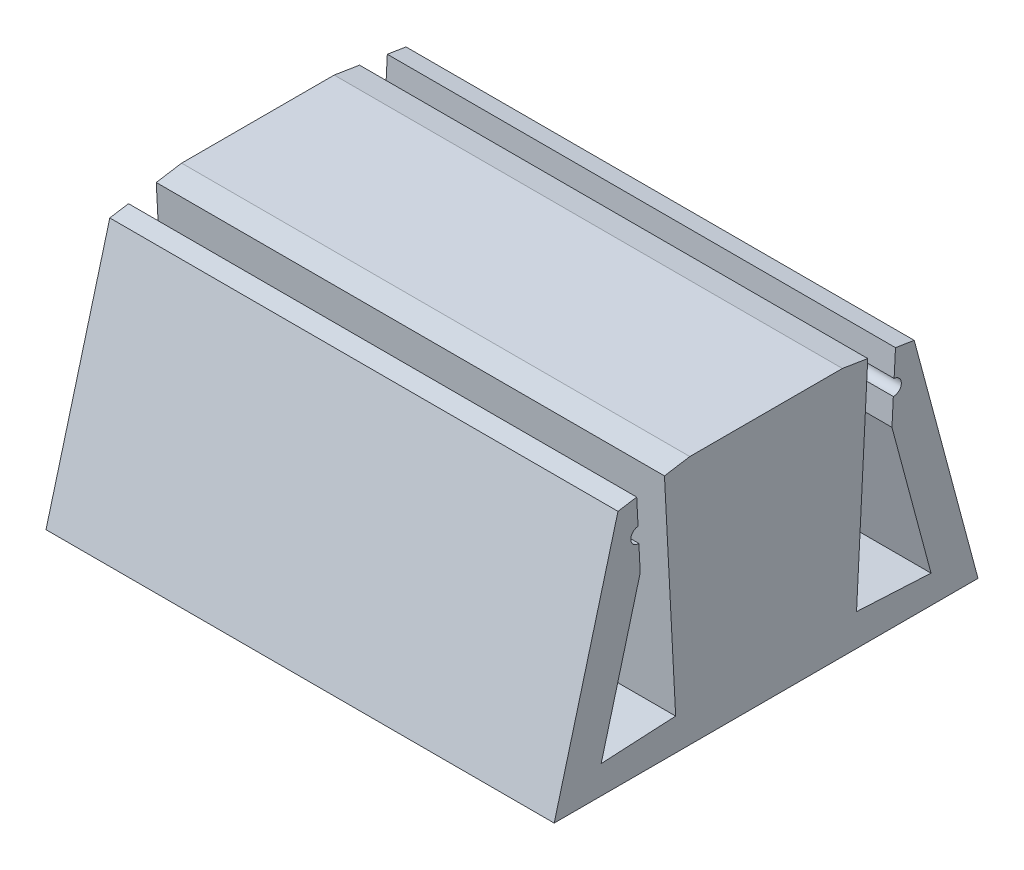
from build123d import *

# Parameters (mm, degrees)
BOSS_EXTRUDE1_DEPTH = 10


with BuildPart() as part:
    # Sketch1 → Boss-Extrude1 (new, symmetric)
    with BuildSketch(Plane(origin=(0, 0, 0), x_dir=(0, 0, -1), z_dir=(1, 0, 0))):
        with BuildLine():
            Line((6.081551938, 6.841542851), (7.61911384, 1.103283712))
            Line((7.61911384, 1.103283712), (4.687365208, 1.256930148))
            Line((4.687365208, 1.256930148), (5.127959845, 9.663976652))
            Line((5.127959845, 9.663976652), (4.1299561, 9.824299843))
            Line((4.1299561, 9.824299843), (-1.874036409, 9.824299843))
            Line((-1.874036409, 9.824299843), (-2.872040155, 9.663976652))
            Line((-2.872040155, 9.663976652), (-2.431445517, 1.256930148))
            Line((-2.431445517, 1.256930148), (-5.36319415, 1.103283712))
            Line((-5.36319415, 1.103283712), (-3.825632248, 6.841542851))
            Line((-3.825632248, 6.841542851), (-3.879292118, 7.86543416))
            ThreePointArc((-3.879292118, 7.86543416), (-4.194581765, 8.149322234), (-3.910693691, 8.464611881))
            Line((-3.910693691, 8.464611881), (-3.964353561, 9.488503191))
            Line((-3.964353561, 9.488503191), (-4.701004321, 9.370164756))
            Line((-4.701004321, 9.370164756), (-7.2117324, 0))
            Line((-7.2117324, 0), (9.46765209, 0))
            Line((9.46765209, 0), (6.956924011, 9.370164756))
            Line((6.956924011, 9.370164756), (6.220273251, 9.488503191))
            Line((6.220273251, 9.488503191), (6.166613382, 8.464611881))
            ThreePointArc((6.166613382, 8.464611881), (6.450501455, 8.149322234), (6.135211808, 7.86543416))
            Line((6.135211808, 7.86543416), (6.081551938, 6.841542851))
        make_face()
    extrude(amount=BOSS_EXTRUDE1_DEPTH, both=True)


solid = part.part
